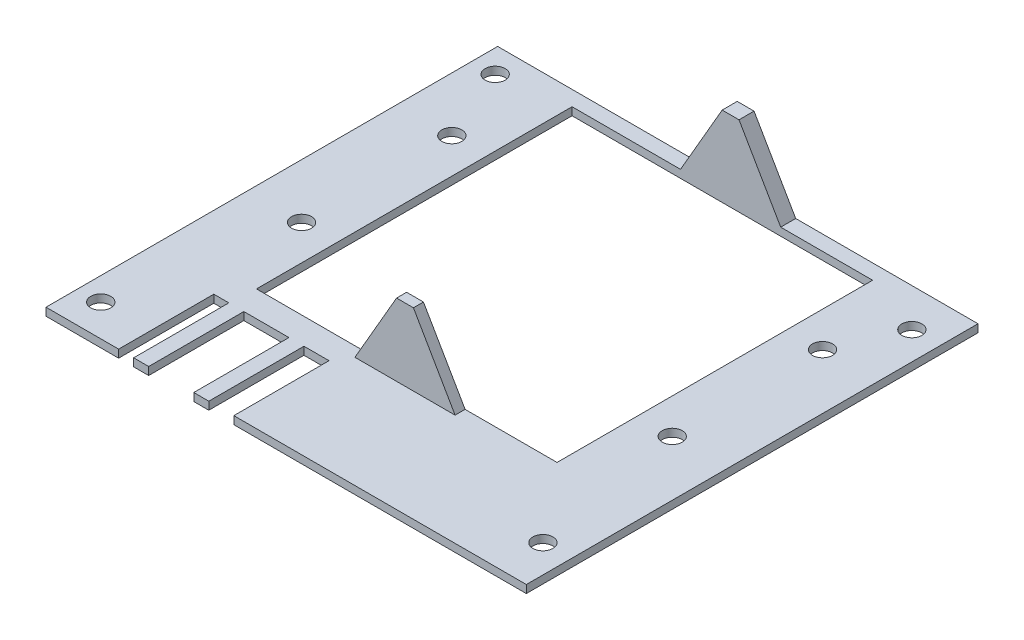
from build123d import *

# Parameters (mm, degrees)
SKETCH1_W               = 96.89
SKETCH1_H               = 90.17
PCB_DEPTH               = 1.57
SKETCH2_R               = 2
M3_MOUNTING_HOLES_DEPTH = 1.57
SKETCH4_R               = 2
CUT_EXTRUDE1_DEPTH      = 23
BOSS_EXTRUDE2_DEPTH     = 2
BOSS_EXTRUDE3_DEPTH     = 3
SKETCH9_W               = 3
SKETCH9_H               = 19
SKETCH9_W_2             = 9
SKETCH9_W_3             = 5
CUT_EXTRUDE2_DEPTH      = 128.304608561
SKETCH10_W              = 0.5
SKETCH10_H              = 90.17
CUT_EXTRUDE3_DEPTH      = 10
SKETCH11_W              = 60
SKETCH11_H              = 63
CUT_EXTRUDE4_DEPTH      = 10


with BuildPart() as part:
    # Sketch1 → PCB (new body)
    with BuildSketch(Plane(origin=(0, 0, 0), x_dir=(1, 0, 0), z_dir=(0, 1, 0))):
        with Locations((16.200949951, 63.633996534)):
            Rectangle(SKETCH1_W, SKETCH1_H)
    extrude(amount=PCB_DEPTH)

    # Sketch2 → M3 Mounting Holes (cut)
    with BuildSketch(Plane(origin=(0, 1.57, 0), x_dir=(1, 0, 0), z_dir=(0, 1, 0))):
        with Locations((58.565949951, 27.438996534)):
            Circle(SKETCH2_R)
        with Locations((-27.164050049, 24.898996534)):
            Circle(SKETCH2_R)
        with Locations((-27.164050049, 103.638996534)):
            Circle(SKETCH2_R)
        with Locations((58.565949951, 101.098996534)):
            Circle(SKETCH2_R)
    extrude(amount=-M3_MOUNTING_HOLES_DEPTH, mode=Mode.SUBTRACT)

    # Sketch4 → Cut-Extrude1 (cut)
    with BuildSketch(Plane(origin=(0, 1.57, 0), x_dir=(1, 0, 0), z_dir=(0, 1, 0))):
        with Locations((-20.894050049, 88.718996534)):
            Circle(SKETCH4_R)
        with Locations((53.105949951, 88.718996534)):
            Circle(SKETCH4_R)
        with Locations((-20.894050049, 58.718996534)):
            Circle(SKETCH4_R)
        with Locations((53.105949951, 58.718996534)):
            Circle(SKETCH4_R)
    extrude(amount=-CUT_EXTRUDE1_DEPTH, mode=Mode.SUBTRACT)

    # Sketch7 → Boss-Extrude2 (add)
    with BuildSketch(Plane.XY.offset(-42.718996534)):
        Polygon((27.755949951, 1.57), (19.438412086, 15.976398176), (16.073487816, 15.976398176), (7.755949951, 1.57), align=None)
    extrude(amount=BOSS_EXTRUDE2_DEPTH)

    # Sketch8 → Boss-Extrude3 (add)
    with BuildSketch(Plane.XY.offset(-108.718996534)):
        Polygon((27.755949951, 1.57), (19.438412086, 15.976398176), (16.073487816, 15.976398176), (7.755949951, 1.57), align=None)
    extrude(amount=BOSS_EXTRUDE3_DEPTH)

    # Sketch9 → Cut-Extrude2 (cut, through all)
    with BuildSketch(Plane(origin=(0, 1.57, 0), x_dir=(1, 0, 0), z_dir=(0, 1, 0))):
        with Locations((-15.744050049, 28.048996534)):
            Rectangle(SKETCH9_W, SKETCH9_H)
        with Locations((-6.744050049, 28.048996534)):
            Rectangle(SKETCH9_W_2, SKETCH9_H)
        with Locations((3.255949951, 28.048996534)):
            Rectangle(SKETCH9_W_3, SKETCH9_H)
    extrude(amount=-CUT_EXTRUDE2_DEPTH, mode=Mode.SUBTRACT)

    # Sketch10 → Cut-Extrude3 (cut)
    with BuildSketch(Plane(origin=(0, 1.57, 0), x_dir=(1, 0, 0), z_dir=(0, 1, 0))):
        with Locations((-31.994050049, 63.633996534)):
            Rectangle(SKETCH10_W, SKETCH10_H)
        with Locations((64.395949951, 63.633996534)):
            Rectangle(SKETCH10_W, SKETCH10_H)
    extrude(amount=-CUT_EXTRUDE3_DEPTH, mode=Mode.SUBTRACT)

    # Sketch11 → Cut-Extrude4 (cut)
    with BuildSketch(Plane(origin=(0, 1.57, 0), x_dir=(1, 0, 0), z_dir=(0, 1, 0))):
        with Locations((16.105949951, 74.218996534)):
            Rectangle(SKETCH11_W, SKETCH11_H)
    extrude(amount=-CUT_EXTRUDE4_DEPTH, mode=Mode.SUBTRACT)


solid = part.part
